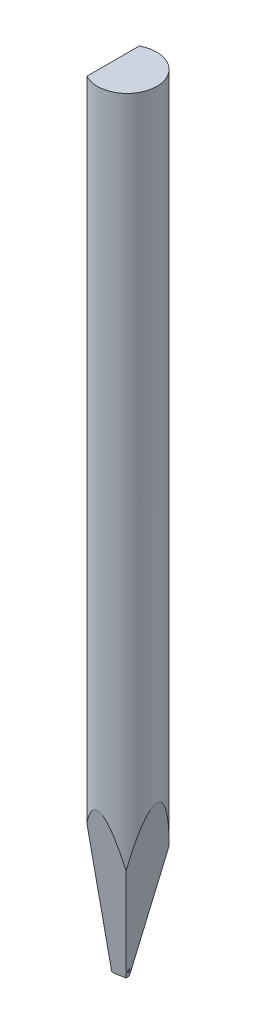
from build123d import *

# Parameters (mm, degrees)
TD_SKETCH_R                             = 0.79248
TL_FEATURE_DEPTH                        = 21.0312
TDF_STD_SKETCH_W                        = 2.09296
TDF_STD_SKETCH_H                        = 2.09296
TDF_STD_FEATURE_DEPTH                   = 22.061040395
ISA_20_STD_FEATURE_DEPTH                = 22.061040395
ISA_20_STD_FEATURE_DEPTH_BACK           = 22.061040395
F_10BA_STD_FEATURE_DEPTH                = 22.061040395
F_10BA_STD_FEATURE_DEPTH_BACK           = 22.061040395
FRO_STD_FEATURE_DEPTH                   = 22.061040395
FRO_STD_FEATURE_DEPTH_BACK              = 22.061040395
C_STD_FEATURE_DEPTH                     = 22.061040395
C_STD_FEATURE_DEPTH_BACK                = 22.061040395
ERW_STD_FEATURE_DEPTH                   = 0.028575
H_STD_FEATURE_REACH                     = 22.881
H_STD_SKETCH_R                          = 0.01905
H_STD_SKETCH_3_R                        = 0.01905
FUNNEL_FINAL_DIAMETRE_STD_FEATURE_DEPTH = 2.499995
FUNNEL_FINAL_DIAMETRE_STD_FEATURE_DRAFT = -22.5
ROUND_BR_STD_FEATURE_START              = -1
ROUND_BR_STD_FEATURE_DEPTH              = 1.020088772


with BuildPart() as part:
    # TD_sketch → TL_feature (new body)
    with BuildSketch(Plane(origin=(0, 0, 0), x_dir=(1, 0, 0), z_dir=(0, 1, 0))):
        with Locations(Location((0, 0, 0), (0, 0, 270))):
            Circle(TD_SKETCH_R)
    extrude(amount=TL_FEATURE_DEPTH)

    # TDF_STD_sketch → TDF_STD_feature (cut, through all)
    with BuildSketch(Plane(origin=(0, 0, 0), x_dir=(1, 0, 0), z_dir=(0, 1, 0))):
        with Locations((-1.4224, 0)):
            Rectangle(TDF_STD_SKETCH_W, TDF_STD_SKETCH_H)
    extrude(amount=TDF_STD_FEATURE_DEPTH, mode=Mode.SUBTRACT)

    # ISA_20_STD_sketch → ISA_20_STD_feature (cut, two sides: drawn at the far end of the back side and taken through both)
    with BuildSketch(Plane(origin=(0, 0, 0), x_dir=(0, 0, -1), z_dir=(1, 0, 0)).offset(-ISA_20_STD_FEATURE_DEPTH_BACK)):
        Polygon((-12.952451681, 73.255332957), (-3.743927997, 21.0312), (-0.03556, 0), (0.03556, 0), (3.743927997, 21.0312), (12.952451681, 73.255332957), (12.952451681, -32.804215817), (-12.952451681, -32.804215817), align=None)
    extrude(amount=ISA_20_STD_FEATURE_DEPTH + ISA_20_STD_FEATURE_DEPTH_BACK, mode=Mode.SUBTRACT)

    # 10BA_STD_sketch → 10BA_STD_feature (cut, two sides: drawn at the far end of the back side and taken through both)
    with BuildSketch(Plane.XY.offset(-F_10BA_STD_FEATURE_DEPTH_BACK)):
        Polygon((-53.226091717, 0), (-0.37592, 0), (-0.28702, 0), (0.014453164, 0.053157853), (3.713447997, 21.0312), (12.890784005, 73.078458855), (91.272293615, 2.163710365), (25.155417893, -70.914748491), align=None)
    extrude(amount=F_10BA_STD_FEATURE_DEPTH + F_10BA_STD_FEATURE_DEPTH_BACK, mode=Mode.SUBTRACT)

    # FRO_STD_sketch → FRO_STD_feature (cut, two sides: drawn at the far end of the back side and taken through both)
    with BuildSketch(Plane.XY.offset(-FRO_STD_FEATURE_DEPTH_BACK)):
        with BuildLine():
            Line((-0.37592, 52.147609748), (-0.37592, 0.02286))
            ThreePointArc((-0.37592, 0.02286), (-0.369224461, 0.006695539), (-0.35306, 0))
            Line((-0.35306, 0), (51.771689748, 0))
            Line((51.771689748, 0), (-21.943838281, -73.715528029))
            Line((-21.943838281, -73.715528029), (-74.091448029, -21.567918281))
            Line((-74.091448029, -21.567918281), (-0.37592, 52.147609748))
        make_face()
    extrude(amount=FRO_STD_FEATURE_DEPTH + FRO_STD_FEATURE_DEPTH_BACK, mode=Mode.SUBTRACT)

    # C_STD_sketch → C_STD_feature (cut, two sides: drawn at the far end of the back side and taken through both)
    with BuildSketch(Plane(origin=(0, 0, 0), x_dir=(0, 0, -1), z_dir=(1, 0, 0)).offset(-C_STD_FEATURE_DEPTH_BACK)):
        with BuildLine():
            Line((-50.946547499, -11.043402092), (-0.035537314, 0))
            ThreePointArc((-0.035537314, 0), (0, 0.00381), (0.035537314, 0))
            Line((0.035537314, 0), (50.946547499, -11.043402092))
            Line((50.946547499, -11.043402092), (50.946547499, -115.233376423))
            Line((50.946547499, -115.233376423), (-50.946547499, -115.233376423))
            Line((-50.946547499, -115.233376423), (-50.946547499, -11.043402092))
        make_face()
    extrude(amount=C_STD_FEATURE_DEPTH + C_STD_FEATURE_DEPTH_BACK, mode=Mode.SUBTRACT)


with BuildPart() as body_2:
    # ERW_STD_sketch → ERW_STD_feature (new, symmetric)
    with BuildSketch(Plane.XY):
        Polygon((-0.127, 0.09652), (-0.127, 0), (-0.3175, 0), (-0.261774152, 0.09652), align=None)
    extrude(amount=ERW_STD_FEATURE_DEPTH, both=True)

    # H_STD_sketch → H_STD_feature (add, up to next)
    with BuildSketch(Plane(origin=(0.01693898, 0.179623209, 0), x_dir=(0, 0, -1), z_dir=(0.8660254037844415, 0.4999999999999953, 0)), mode=Mode.PRIVATE) as h_std_feature_sk1:
        with Locations(Location((0, 0, 0), (0, 0, 90))):
            Circle(H_STD_SKETCH_R)
    h_std_feature_tool1 = extrude(h_std_feature_sk1.sketch, amount=-H_STD_FEATURE_REACH, mode=Mode.PRIVATE) - body_2.part
    add(h_std_feature_tool1.solids().sort_by_distance((0.016939, 0.179623, 0))[0])


with BuildPart() as funnel_final_diametre_std_feature_tool:
    # H_STD_sketch<3> → funnel_final_diametre_STD_feature (with draft: the straight prism first)
    with BuildSketch(Plane(origin=(0.01693898, 0.179623209, 0), x_dir=(0, 0, -1), z_dir=(0.8660254037844415, 0.4999999999999953, 0))):
        with Locations(Location((0, 0, 0), (0, 0, 90))):
            Circle(H_STD_SKETCH_3_R)
    extrude(amount=FUNNEL_FINAL_DIAMETRE_STD_FEATURE_DEPTH)
    # funnel_final_diametre_STD_feature: the draft: its side faces are tilted about the plane it starts from
    funnel_final_diametre_std_feature_sides = [funnel_final_diametre_std_feature_tool.faces().sort_by_distance(p)[0] for p in [
        (1.10899357, 0.788124175, 0),
    ]]
    draft(funnel_final_diametre_std_feature_sides, Plane(origin=(0.01693898, 0.179623209, 0), x_dir=(0, 0, -1), z_dir=(0.8660254037844415, 0.4999999999999953, 0)), FUNNEL_FINAL_DIAMETRE_STD_FEATURE_DRAFT)


with BuildPart() as body_2_1:
    add(body_2.part)

    # funnel_final_diametre_STD_feature: add funnel_final_diametre_std_feature_tool
    add(funnel_final_diametre_std_feature_tool.part)

    # ROUND_BR_STD_feature: read off the stored shape, not the designer's step
    # ROUND_BR_STD_feature outline → ROUND_BR_STD_feature (cut)
    with BuildSketch(Plane(origin=(0, 0, 0), x_dir=(0.8660254037844362, -0.5000000000000042, 0), z_dir=(0.5000000000000042, 0.8660254037844363, 0)).offset(ROUND_BR_STD_FEATURE_START)):
        with BuildLine():
            Line((-0.274963066, -0.028575), (-0.246388066, -0.028575))
            ThreePointArc((-0.246388066, -0.028575), (-0.266593642, -0.020205576), (-0.274963066, 0))
            Line((-0.274963066, 0), (-0.274963066, -0.028575))
        make_face()
        with BuildLine():
            Line((-0.274963066, 0.028575), (-0.274963066, 0))
            ThreePointArc((-0.274963066, 0), (-0.266593642, 0.020205576), (-0.246388066, 0.028575))
            Line((-0.246388066, 0.028575), (-0.274963066, 0.028575))
        make_face()
    extrude(amount=ROUND_BR_STD_FEATURE_DEPTH, mode=Mode.SUBTRACT)


with BuildPart() as part_1:
    add(part.part)

    # COMBINE_STD_feature: cut body 2
    add(body_2_1.part, mode=Mode.SUBTRACT)


solid = part_1.part
